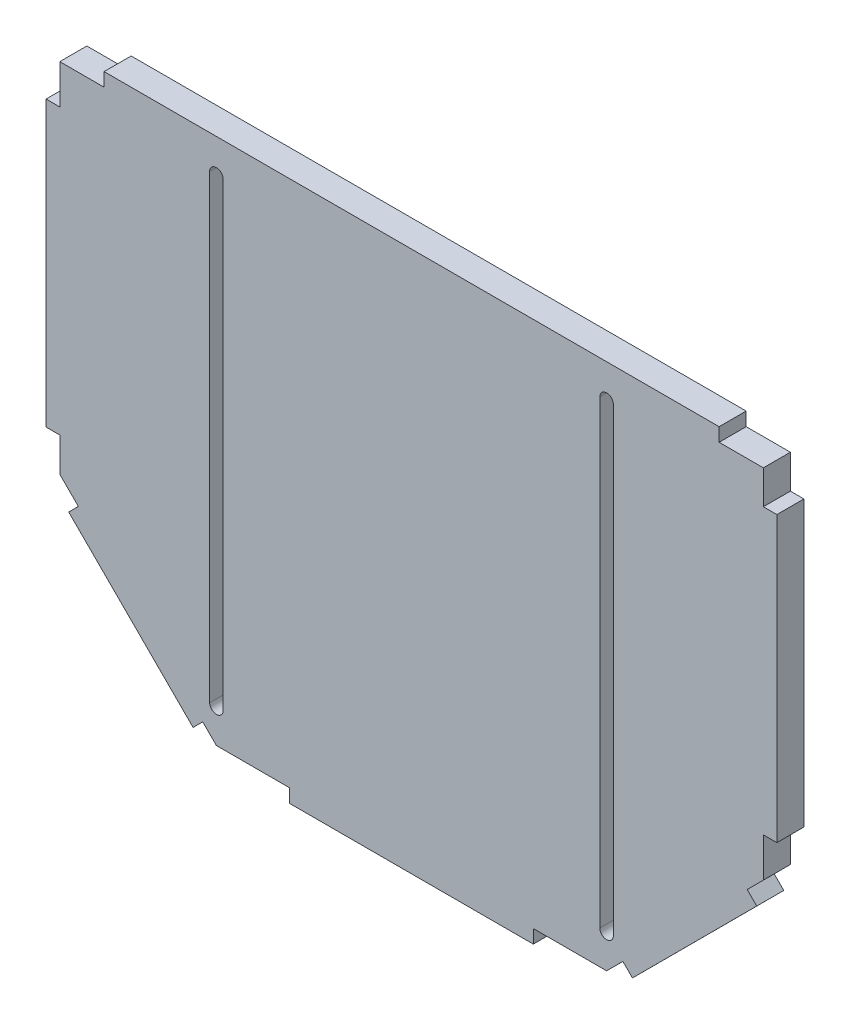
from build123d import *

# Parameters (mm, degrees)
BOSS_EXTRUDE1_DEPTH = 12.7
CUT_EXTRUDE1_DEPTH  = 6.35


with BuildPart() as part:
    # Sketch2 → Boss-Extrude1 (new body)
    with BuildSketch(Plane.XY):
        Polygon((0.16511791, 2.594153673), (34.58211791, 2.594153673), (34.58211791, -3.755846327), (148.88211791, -3.755846327), (148.88211791, 2.594153673), (183.29911791, 2.594153673), (190.928053043, 10.231651544), (195.42069885, 5.744042643), (253.75961457, 64.148438133), (249.266968763, 68.636047035), (256.854659148, 76.232253865), (256.854659148, 94.647253865), (263.204659148, 94.647253865), (263.204659148, 227.997253865), (256.854659148, 227.997253865), (256.854659148, 243.818100193), (236.100718742, 243.818100193), (236.100718742, 250.168100193), (-52.546317971, 250.168100193), (-52.546317971, 243.818100193), (-73.345340852, 243.818100193), (-73.345340852, 225.403100193), (-79.777899807, 225.403100193), (-79.777899807, 92.053100193), (-73.345340852, 92.053100193), (-73.345340852, 76.104612435), (-64.625246699, 67.384518281), (-69.156654237, 62.853110743), (-10.78498945, 4.481445956), (-6.253581912, 9.012853494), align=None)
    extrude(amount=BOSS_EXTRUDE1_DEPTH)

    # Sketch3 → Cut-Extrude1 (cut)
    with BuildSketch(Plane.XY.offset(12.7)):
        with BuildLine():
            Line((-3.00988209, 234.331126933), (-3.00988209, 18.431126933))
            ThreePointArc((-3.00988209, 18.431126933), (0.16511791, 15.256126933), (3.34011791, 18.431126933))
            Line((3.34011791, 18.431126933), (3.34011791, 234.331126933))
            ThreePointArc((3.34011791, 234.331126933), (0.16511791, 237.506126933), (-3.00988209, 234.331126933))
        make_face()
        with BuildLine():
            Line((180.12411791, 234.331126933), (180.12411791, 18.431126933))
            ThreePointArc((180.12411791, 18.431126933), (183.29911791, 15.256126933), (186.47411791, 18.431126933))
            Line((186.47411791, 18.431126933), (186.47411791, 234.331126933))
            ThreePointArc((186.47411791, 234.331126933), (183.29911791, 237.506126933), (180.12411791, 234.331126933))
        make_face()
    extrude(amount=-CUT_EXTRUDE1_DEPTH, mode=Mode.SUBTRACT)


solid = part.part
